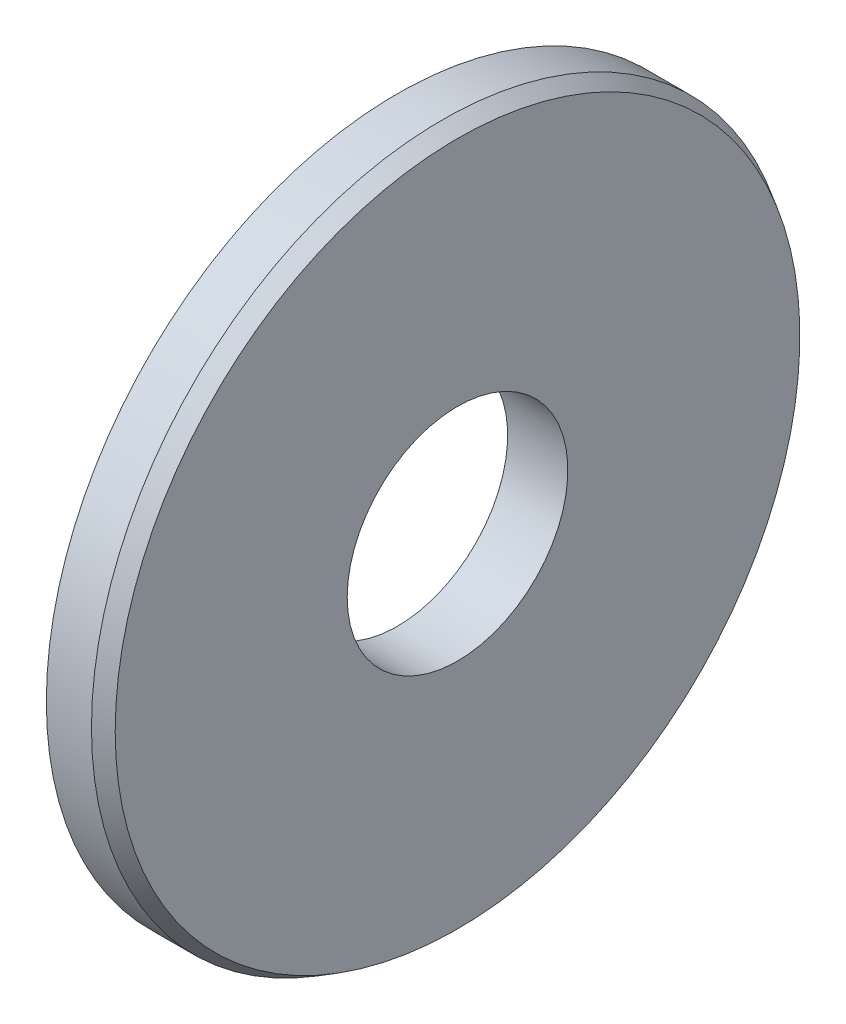
from build123d import *

# Parameters (mm, degrees)
SKETCH_1_W      = 0.3
SKETCH_1_H      = 1.2
CHAMFER_1_SIZE  = 0.075
CHAMFER_1_SIZE2 = 0.04330127


with BuildPart() as part:
    # Эскиз1 → Повернуть1 (revolve)
    with BuildSketch(Plane.XY):
        with Locations((0, 1.15)):
            Rectangle(SKETCH_1_W, SKETCH_1_H)
    revolve(axis=Axis((-1000, 0, 0), (1, 0, 0)))

    # Фаска1
    chamfer_1_edges = [part.edges().sort_by_distance(p)[0] for p in [
        (0.15, -1.75, 0),
    ]]
    chamfer_1_side = [part.faces().sort_by_distance(p)[0] for p in [
        (0, -1.75, 0),
    ]]
    chamfer(chamfer_1_edges, length=CHAMFER_1_SIZE, length2=CHAMFER_1_SIZE2, reference=chamfer_1_side[0])


solid = part.part
